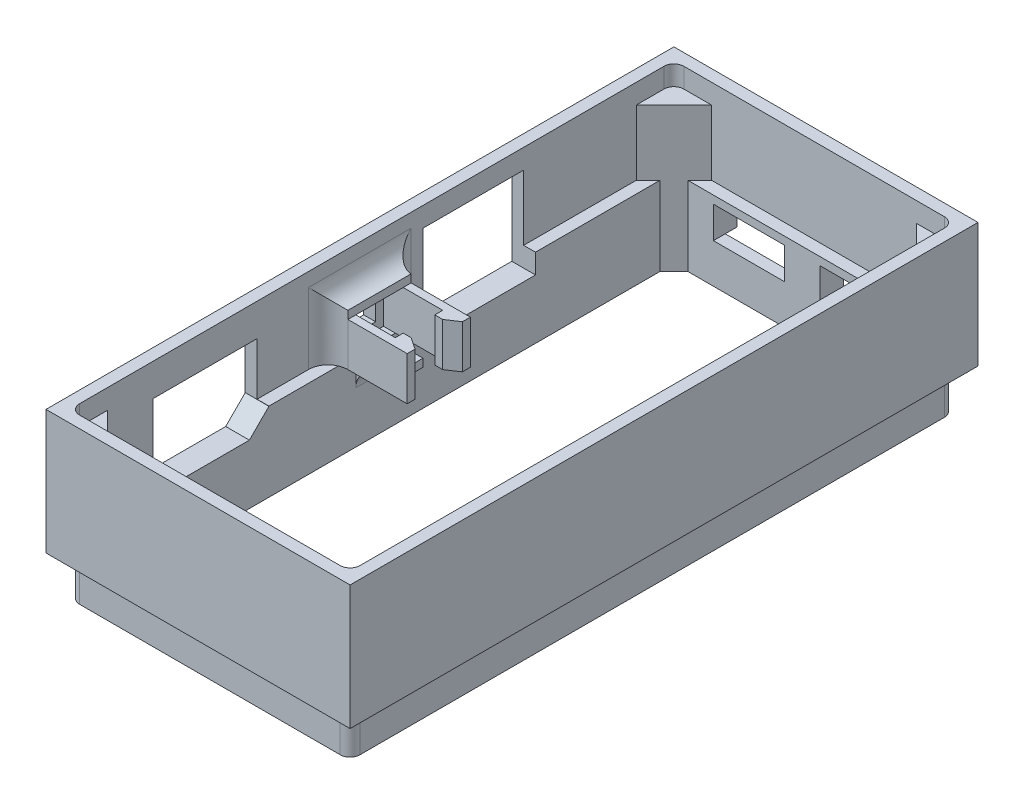
from build123d import *

# Parameters (mm, degrees)
SKETCH1_W           = 71
SKETCH1_H           = 153
SKETCH1_W_2         = 65
SKETCH1_H_2         = 147
BOSS_EXTRUDE1_DEPTH = 10
SKETCH2_W           = 77
SKETCH2_H           = 159
SKETCH2_W_2         = 71
SKETCH2_H_2         = 153
BOSS_EXTRUDE2_DEPTH = 60
SKETCH3_W           = 71
SKETCH3_H           = 153
SKETCH3_W_2         = 65
SKETCH3_H_2         = 147
BOSS_EXTRUDE3_DEPTH = 10
RIB17_REACH         = 188.312
SKETCH7_WALL_W      = 379.62313401
SKETCH7_WALL_H      = 60
RIB22_REACH         = 188.312
SKETCH9_WALL_W      = 379.62313401
SKETCH9_WALL_H      = 60
RIB23_REACH         = 188.312
SKETCH10_WALL_W     = 379.62313401
SKETCH10_WALL_H     = 60
RIB24_REACH         = 188.312
SKETCH11_WALL_W     = 379.62313401
SKETCH11_WALL_H     = 60
FILLET1_R           = 2.5
FILLET2_R           = 3
SKETCH12_W          = 18
SKETCH12_H          = 8
CUT_EXTRUDE1_DEPTH  = 10
SKETCH13_W          = 12
SKETCH13_H          = 11
SKETCH13_W_2        = 25.5
SKETCH13_H_2        = 21.5
CUT_EXTRUDE2_DEPTH  = 10
SKETCH14_W          = 77
SKETCH14_H          = 159
CUT_EXTRUDE3_DEPTH  = 28.5
SKETCH15_W          = 71
SKETCH15_H          = 153
CUT_EXTRUDE4_DEPTH  = 5
FILLET3_R           = 2.5
SKETCH16_W          = 2
SKETCH16_H          = 11
BOSS_EXTRUDE4_DEPTH = 17
BOSS_EXTRUDE5_DEPTH = 11
SKETCH19_W          = 8
SKETCH19_H          = 2
BOSS_EXTRUDE7_DEPTH = 9
SKETCH20_W          = 8
SKETCH20_H          = 7
BOSS_EXTRUDE8_DEPTH = 3
SKETCH21_W          = 16
SKETCH21_H          = 2
BOSS_EXTRUDE9_DEPTH = 5
FILLET4_R           = 5


with BuildPart() as part:
    # Sketch1 → Boss-Extrude1 (new body)
    with BuildSketch(Plane(origin=(0, 0, 0), x_dir=(1, 0, 0), z_dir=(0, 1, 0))):
        with Locations((-35.5, 76.5)):
            Rectangle(SKETCH1_W, SKETCH1_H)
        with Locations((-35.5, 76.5)):
            Rectangle(SKETCH1_W_2, SKETCH1_H_2, mode=Mode.SUBTRACT)
    extrude(amount=BOSS_EXTRUDE1_DEPTH)



with BuildPart() as body_2:
    # Sketch2 → Boss-Extrude2 (new body)
    with BuildSketch(Plane(origin=(0, 10, 0), x_dir=(1, 0, 0), z_dir=(0, 1, 0))):
        with Locations((-35.5, 76.5)):
            Rectangle(SKETCH2_W, SKETCH2_H)
        with Locations((-35.5, 76.5)):
            Rectangle(SKETCH2_W_2, SKETCH2_H_2, mode=Mode.SUBTRACT)
    extrude(amount=BOSS_EXTRUDE2_DEPTH)


with BuildPart() as part_1:
    add(part.part)

    add(body_2.part)  # Boss-Extrude3 merges body 2
    # Sketch3 → Boss-Extrude3 (add)
    with BuildSketch(Plane(origin=(0, 10, 0), x_dir=(1, 0, 0), z_dir=(0, 1, 0))):
        with Locations((-35.5, 76.5)):
            Rectangle(SKETCH3_W, SKETCH3_H)
        with Locations((-35.5, 76.5)):
            Rectangle(SKETCH3_W_2, SKETCH3_H_2, mode=Mode.SUBTRACT)
    extrude(amount=BOSS_EXTRUDE3_DEPTH)

    # Sketch7 wall → Rib17 (add, up to next)
    with BuildSketch(Plane(origin=(-66.232233047, 0, -4.767766953), x_dir=(0.707106781187, 0, 0.707106781187), z_dir=(-0.707106781187, 0, 0.707106781187)), mode=Mode.PRIVATE) as rib17_sk1:
        with Locations((0, 30)):
            Rectangle(SKETCH7_WALL_W, SKETCH7_WALL_H)
    rib17_tool1 = extrude(rib17_sk1.sketch, amount=RIB17_REACH, mode=Mode.PRIVATE) - part_1.part
    add(rib17_tool1.solids().sort_by_distance((-66.232233047, 0, -4.767766953))[0])

    # Sketch9 wall → Rib22 (add, up to next)
    with BuildSketch(Plane(origin=(-66.232233047, 0, -148.232233047), x_dir=(0.707106781187, 0, -0.707106781187), z_dir=(0.707106781187, 0, 0.707106781187)), mode=Mode.PRIVATE) as rib22_sk1:
        with Locations((0, 30)):
            Rectangle(SKETCH9_WALL_W, SKETCH9_WALL_H)
    rib22_tool1 = extrude(rib22_sk1.sketch, amount=-RIB22_REACH, mode=Mode.PRIVATE) - part_1.part
    add(rib22_tool1.solids().sort_by_distance((-66.232233047, 0, -148.232233047))[0])

    # Sketch10 wall → Rib23 (add, up to next)
    with BuildSketch(Plane(origin=(-4.767766953, 0, -148.232233047), x_dir=(0.707106781187, 0, 0.707106781187), z_dir=(-0.707106781187, 0, 0.707106781187)), mode=Mode.PRIVATE) as rib23_sk1:
        with Locations((0, 30)):
            Rectangle(SKETCH10_WALL_W, SKETCH10_WALL_H)
    rib23_tool1 = extrude(rib23_sk1.sketch, amount=-RIB23_REACH, mode=Mode.PRIVATE) - part_1.part
    add(rib23_tool1.solids().sort_by_distance((-4.767766953, 0, -148.232233047))[0])

    # Sketch11 wall → Rib24 (add, up to next)
    with BuildSketch(Plane(origin=(-4.767766953, 0, -4.767766953), x_dir=(0.707106781187, 0, -0.707106781187), z_dir=(0.707106781187, 0, 0.707106781187)), mode=Mode.PRIVATE) as rib24_sk1:
        with Locations((0, 30)):
            Rectangle(SKETCH11_WALL_W, SKETCH11_WALL_H)
    rib24_tool1 = extrude(rib24_sk1.sketch, amount=RIB24_REACH, mode=Mode.PRIVATE) - part_1.part
    add(rib24_tool1.solids().sort_by_distance((-4.767766953, 0, -4.767766953))[0])

    # Fillet1
    fillet1_edges = [part_1.edges().sort_by_distance(p)[0] for p in [
        (0, 5, 0),
        (-71, 5, 0),
        (-71, 5, -153),
        (0, 5, -153),
    ]]
    fillet(fillet1_edges, radius=FILLET1_R)

    # Fillet2
    fillet2_edges = [part_1.edges().sort_by_distance(p)[0] for p in [
        (-71, 65, 0),
        (0, 65, 0),
        (0, 65, -153),
        (-71, 65, -153),
    ]]
    fillet(fillet2_edges, radius=FILLET2_R)

    # Sketch12 → Cut-Extrude1 (cut)
    with BuildSketch(Plane(origin=(0, 0, -156), x_dir=(-1, 0, 0), z_dir=(0, 0, -1))):
        with Locations((22, 14)):
            Rectangle(SKETCH12_W, SKETCH12_H)
        with Locations((49, 14)):
            Rectangle(SKETCH12_W, SKETCH12_H)
    extrude(amount=-CUT_EXTRUDE1_DEPTH, mode=Mode.SUBTRACT)

    # Sketch13 → Cut-Extrude2 (cut)
    with BuildSketch(Plane.ZY.offset(74)):
        Polygon((-47.45, 19.949747468), (-42.500252532, 15), (-25.999747468, 15), (-21.05, 19.949747468), (-21.05, 33.3), (-47.45, 33.3), align=None)
        with Locations((-73.45, 25.5)):
            Rectangle(SKETCH13_W, SKETCH13_H)
        with Locations((-102.2, 25.75)):
            Rectangle(SKETCH13_W_2, SKETCH13_H_2)
    extrude(amount=-CUT_EXTRUDE2_DEPTH, mode=Mode.SUBTRACT)

    # Sketch14 → Cut-Extrude3 (cut)
    with BuildSketch(Plane(origin=(0, 70, 0), x_dir=(1, 0, 0), z_dir=(0, 1, 0))):
        with Locations((-35.5, 76.5)):
            Rectangle(SKETCH14_W, SKETCH14_H)
    extrude(amount=-CUT_EXTRUDE3_DEPTH, mode=Mode.SUBTRACT)

    # Sketch15 → Cut-Extrude4 (cut)
    with BuildSketch(Plane(origin=(0, 41.5, 0), x_dir=(1, 0, 0), z_dir=(0, 1, 0))):
        with Locations((-35.5, 76.5)):
            Rectangle(SKETCH15_W, SKETCH15_H)
    extrude(amount=-CUT_EXTRUDE4_DEPTH, mode=Mode.SUBTRACT)

    # Fillet3
    fillet3_edges = [part_1.edges().sort_by_distance(p)[0] for p in [
        (-71, 39, 0),
        (-71, 39, -153),
        (0, 39, -153),
        (0, 39, 0),
    ]]
    fillet(fillet3_edges, radius=FILLET3_R)

    # Sketch16 → Boss-Extrude4 (add)
    with BuildSketch(Plane(origin=(-71, 0, 0), x_dir=(0, 0, -1), z_dir=(1, 0, 0))):
        with Locations((66.45, 25.5)):
            Rectangle(SKETCH16_W, SKETCH16_H)
        with Locations((80.45, 25.5)):
            Rectangle(SKETCH16_W, SKETCH16_H)
    extrude(amount=BOSS_EXTRUDE4_DEPTH)

    # Sketch17 → Boss-Extrude5 (add)
    with BuildSketch(Plane(origin=(0, 31, 0), x_dir=(1, 0, 0), z_dir=(0, 1, 0))):
        Polygon((-54, 79.45), (-56, 79.45), (-56, 77.45), (-54, 77.45), (-51, 79.45), (-51, 81.45), (-54, 81.45), align=None)
        Polygon((-56, 67.45), (-56, 69.45), (-54, 69.45), (-51, 67.45), (-51, 65.45), (-54, 65.45), (-54, 67.45), align=None)
    extrude(amount=-BOSS_EXTRUDE5_DEPTH)

    # Sketch19 → Boss-Extrude7 (add)
    with BuildSketch(Plane(origin=(-68, 0, 0), x_dir=(0, 0, -1), z_dir=(1, 0, 0))):
        with Locations((73.45, 19)):
            Rectangle(SKETCH19_W, SKETCH19_H)
    extrude(amount=BOSS_EXTRUDE7_DEPTH)

    # Sketch20 → Boss-Extrude8 (add)
    with BuildSketch(Plane.ZY.offset(74)):
        Polygon((-79.45, 31), (-77.45, 31), (-69.45, 31), (-67.45, 31), (-67.45, 20), (-69.45, 20), (-77.45, 20), (-79.45, 20), align=None)
        with Locations((-73.45, 25.5)):
            Rectangle(SKETCH20_W, SKETCH20_H, mode=Mode.SUBTRACT)
    extrude(amount=-BOSS_EXTRUDE8_DEPTH)

    # Sketch21 → Boss-Extrude9 (add)
    with BuildSketch(Plane(origin=(-71, 0, 0), x_dir=(0, 0, -1), z_dir=(1, 0, 0))):
        with Locations((73.45, 32)):
            Rectangle(SKETCH21_W, SKETCH21_H)
    extrude(amount=BOSS_EXTRUDE9_DEPTH)

    # Fillet4
    # the kernel refuses this fillet: 5 mm, written as the material it adds along each edge
    with BuildSketch(Plane(origin=(-68, 18, -77.45), x_dir=(0, -1, 0), z_dir=(0, 0, 1))) as fillet4_piece_1:
        with BuildLine():
            CenterArc((FILLET4_R, FILLET4_R), FILLET4_R, 180, 90)
            Line((0, FILLET4_R), (-FILLET4_R * 0.02, FILLET4_R))
            Line((-FILLET4_R * 0.02, FILLET4_R), (-FILLET4_R * 0.02, -FILLET4_R * 0.02))
            Line((-FILLET4_R * 0.02, -FILLET4_R * 0.02), (FILLET4_R, -FILLET4_R * 0.02))
            Line((FILLET4_R, -FILLET4_R * 0.02), (FILLET4_R, 0))
        make_face()
    extrude(amount=8)
    with BuildSketch(Plane(origin=(-71, 33, -81.45), x_dir=(0, 1, 0), z_dir=(0, 0, 1))) as fillet4_piece_2:
        with BuildLine():
            CenterArc((FILLET4_R, -FILLET4_R), FILLET4_R, 90, 90)
            Line((0, -FILLET4_R), (-FILLET4_R * 0.02, -FILLET4_R))
            Line((-FILLET4_R * 0.02, -FILLET4_R), (-FILLET4_R * 0.02, FILLET4_R * 0.02))
            Line((-FILLET4_R * 0.02, FILLET4_R * 0.02), (FILLET4_R, FILLET4_R * 0.02))
            Line((FILLET4_R, FILLET4_R * 0.02), (FILLET4_R, 0))
        make_face()
    extrude(amount=16)
    with BuildSketch(Plane(origin=(-71, 33, -81.45), x_dir=(0, 0, -1), z_dir=(0, -1, 0)), Plane(origin=(-71, 20, -65.45), x_dir=(0, 0, 1), z_dir=(0, 1, 0))) as fillet4_piece_3:
        with BuildLine():
            CenterArc((FILLET4_R, FILLET4_R), FILLET4_R, 180, 90)
            Line((0, FILLET4_R), (-FILLET4_R * 0.02, FILLET4_R))
            Line((-FILLET4_R * 0.02, FILLET4_R), (-FILLET4_R * 0.02, -FILLET4_R * 0.02))
            Line((-FILLET4_R * 0.02, -FILLET4_R * 0.02), (FILLET4_R, -FILLET4_R * 0.02))
            Line((FILLET4_R, -FILLET4_R * 0.02), (FILLET4_R, 0))
        make_face()
    extrude(amount=13)
    with BuildSketch(Plane(origin=(-71, 45.5, -81.45), x_dir=(0, 0, -1), z_dir=(0, -1, 0))) as fillet4_piece_4a_section:
        with BuildLine():
            CenterArc((FILLET4_R, FILLET4_R), FILLET4_R, 180, 90)
            Line((0, FILLET4_R), (-FILLET4_R * 0.02, FILLET4_R))
            Line((-FILLET4_R * 0.02, FILLET4_R), (-FILLET4_R * 0.02, -FILLET4_R * 0.02))
            Line((-FILLET4_R * 0.02, -FILLET4_R * 0.02), (FILLET4_R, -FILLET4_R * 0.02))
            Line((FILLET4_R, -FILLET4_R * 0.02), (FILLET4_R, 0))
        make_face()
    fillet4_piece_4a = extrude(amount=25.5, mode=Mode.PRIVATE)
    fillet4_piece_4a = split(fillet4_piece_4a, bisect_by=Plane(origin=(-69.868024429, 33, -82.581975571), z_dir=(0, 1, 0)), keep=Keep.TOP, mode=Mode.PRIVATE)
    with BuildSketch(Plane(origin=(-71, 33, -93.95), x_dir=(0, 1, 0), z_dir=(0, 0, 1))) as fillet4_piece_4b_section:
        with BuildLine():
            CenterArc((FILLET4_R, -FILLET4_R), FILLET4_R, 90, 90)
            Line((0, -FILLET4_R), (-FILLET4_R * 0.02, -FILLET4_R))
            Line((-FILLET4_R * 0.02, -FILLET4_R), (-FILLET4_R * 0.02, FILLET4_R * 0.02))
            Line((-FILLET4_R * 0.02, FILLET4_R * 0.02), (FILLET4_R, FILLET4_R * 0.02))
            Line((FILLET4_R, FILLET4_R * 0.02), (FILLET4_R, 0))
        make_face()
    fillet4_piece_4b = extrude(amount=28.5, mode=Mode.PRIVATE)
    fillet4_piece_4b = split(fillet4_piece_4b, bisect_by=Plane(origin=(-69.868024429, 34.131975571, -81.45), z_dir=(0, 0, -1)), keep=Keep.TOP, mode=Mode.PRIVATE)
    fillet4_piece_4 = fillet4_piece_4a & fillet4_piece_4b
    add(fillet4_piece_4)
    with BuildSketch(Plane(origin=(-71, 33, -81.45), x_dir=(0, 1, 0), z_dir=(0, 0, 1))) as fillet4_piece_5a_section:
        with BuildLine():
            CenterArc((FILLET4_R, -FILLET4_R), FILLET4_R, 90, 90)
            Line((0, -FILLET4_R), (-FILLET4_R * 0.02, -FILLET4_R))
            Line((-FILLET4_R * 0.02, -FILLET4_R), (-FILLET4_R * 0.02, FILLET4_R * 0.02))
            Line((-FILLET4_R * 0.02, FILLET4_R * 0.02), (FILLET4_R, FILLET4_R * 0.02))
            Line((FILLET4_R, FILLET4_R * 0.02), (FILLET4_R, 0))
        make_face()
    fillet4_piece_5a = extrude(amount=28.5, mode=Mode.PRIVATE)
    fillet4_piece_5a = split(fillet4_piece_5a, bisect_by=Plane(origin=(-69.868024429, 34.131975571, -65.45), z_dir=(0, 0, 1)), keep=Keep.TOP, mode=Mode.PRIVATE)
    with BuildSketch(Plane(origin=(-71, 20, -65.45), x_dir=(0, 0, 1), z_dir=(0, 1, 0))) as fillet4_piece_5b_section:
        with BuildLine():
            CenterArc((FILLET4_R, FILLET4_R), FILLET4_R, 180, 90)
            Line((0, FILLET4_R), (-FILLET4_R * 0.02, FILLET4_R))
            Line((-FILLET4_R * 0.02, FILLET4_R), (-FILLET4_R * 0.02, -FILLET4_R * 0.02))
            Line((-FILLET4_R * 0.02, -FILLET4_R * 0.02), (FILLET4_R, -FILLET4_R * 0.02))
            Line((FILLET4_R, -FILLET4_R * 0.02), (FILLET4_R, 0))
        make_face()
    fillet4_piece_5b = extrude(amount=25.5, mode=Mode.PRIVATE)
    fillet4_piece_5b = split(fillet4_piece_5b, bisect_by=Plane(origin=(-69.868024429, 33, -64.318024429), z_dir=(0, 1, 0)), keep=Keep.TOP, mode=Mode.PRIVATE)
    fillet4_piece_5 = fillet4_piece_5a & fillet4_piece_5b
    add(fillet4_piece_5)


solid = part_1.part
